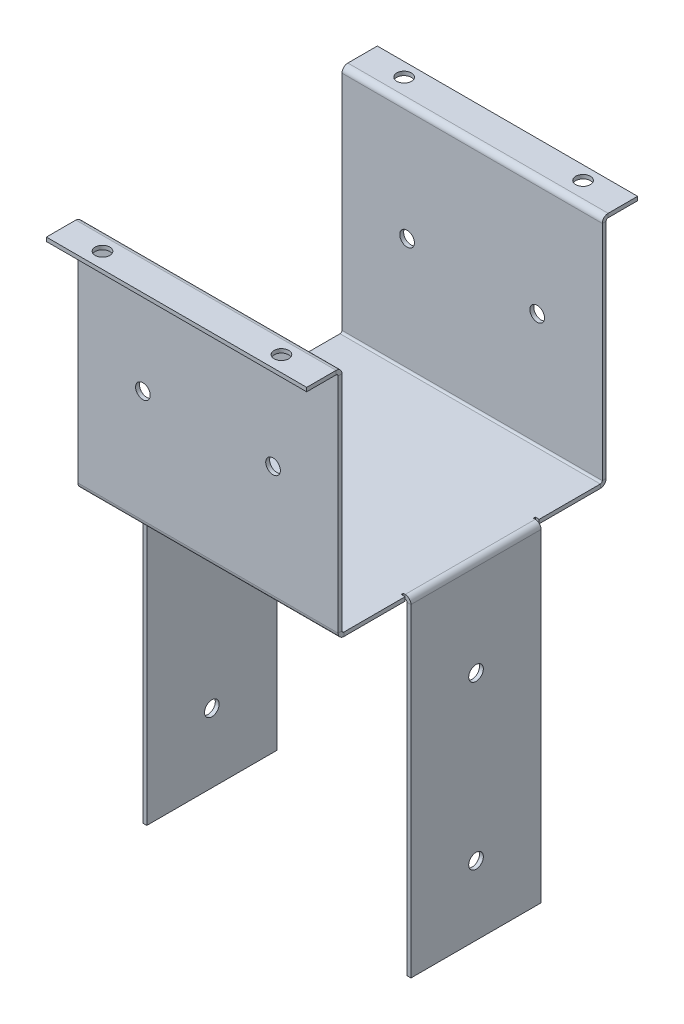
from build123d import *

# Parameters (mm, degrees)
BASE_FLANGE1_DEPTH              = 50.8
EDGE_FLANGE1_STRIP_W            = 7.59968
EDGE_FLANGE1_STRIP_H            = 1.51892
EDGE_FLANGE1_STRIP_CUT_DEPTH    = 50.8
EDGE_FLANGE1_RELIEF_W           = 8.35914
EDGE_FLANGE1_RELIEF_H           = 0.75946
EDGE_FLANGE1_RELIEF_CUT_DEPTH   = 1.51892
EDGE_FLANGE1_STRIP_2_W          = 7.59968
EDGE_FLANGE1_STRIP_2_H          = 1.51892
EDGE_FLANGE1_STRIP_CUT_2_DEPTH  = 50.8
EDGE_FLANGE1_RELIEF_2_W         = 8.35914
EDGE_FLANGE1_RELIEF_2_H         = 0.75946
EDGE_FLANGE1_RELIEF_CUT_2_DEPTH = 1.51892
EDGE_FLANGE1_DEPTH              = 50.8
EDGE_FLANGE1_BEND_DEPTH         = 50.8
SKETCHED_START                  = -50.8
SKETCHED_BEND1_DEPTH            = 101.6
SKETCHED_BEND1_2_DEPTH          = 101.6
SKETCHED_BEND2_DEPTH            = 101.6
SKETCHED_BEND2_2_DEPTH          = 101.6
SKETCH15_R                      = 2.8575
CUT_EXTRUDE1_DEPTH              = 178.869439856
SKETCH17_R                      = 2.8575
CUT_EXTRUDE2_DEPTH              = 2.54
SKETCH18_R                      = 2.8575
CUT_EXTRUDE3_DEPTH              = 182.441822775


# Read off the part's stored shape, not the designer's step: Sketched Bend1, Sketched Bend2
# Sheet-metal steps are written as plain solids
with BuildPart() as part:
    # Sketch2 → Base-Flange1 (new, symmetric)
    with BuildSketch(Plane(origin=(0, 0, 0), x_dir=(0, 0, -1), z_dir=(1, 0, 0))):
        with BuildLine():
            Line((-50.8, 101.6), (-50.8, 0.762))
            ThreePointArc((-50.8, 0.762), (-50.576815367, 0.223184633), (-50.038, 0))
            Line((-50.038, 0), (50.038, 0))
            ThreePointArc((50.038, 0), (50.576815367, 0.223184633), (50.8, 0.762))
            Line((50.8, 0.762), (50.8, 101.6))
            Line((50.8, 101.6), (52.31892, 101.6))
            Line((52.31892, 101.6), (52.31892, 0.762))
            ThreePointArc((52.31892, 0.762), (51.650853999, -0.850853999), (50.038, -1.51892))
            Line((50.038, -1.51892), (-50.038, -1.51892))
            ThreePointArc((-50.038, -1.51892), (-51.650853999, -0.850853999), (-52.31892, 0.762))
            Line((-52.31892, 0.762), (-52.31892, 101.6))
            Line((-52.31892, 101.6), (-50.8, 101.6))
        make_face()
    extrude(amount=BASE_FLANGE1_DEPTH, both=True)

    # Edge-Flange1 strip (across the edge) → Edge-Flange1 strip cut (cut)
    with BuildSketch(Plane(origin=(50.8, -1.51892, -25.4), x_dir=(-1, 0, 0), z_dir=(0, 0, 1))):
        with Locations((-3.03784, -0.75946)):
            Rectangle(EDGE_FLANGE1_STRIP_W, EDGE_FLANGE1_STRIP_H)
    extrude(amount=EDGE_FLANGE1_STRIP_CUT_DEPTH, mode=Mode.SUBTRACT)

    # Edge-Flange1 relief (on the sheet) → Edge-Flange1 relief cut (cut)
    with BuildSketch(Plane(origin=(50.038, -1.51892, -25.4), x_dir=(-1, 0, 0), z_dir=(0, -1, 0))):
        with Locations((-3.42011, 0.37973)):
            Rectangle(EDGE_FLANGE1_RELIEF_W, EDGE_FLANGE1_RELIEF_H)
        with Locations((-3.42011, -51.17973)):
            Rectangle(EDGE_FLANGE1_RELIEF_W, EDGE_FLANGE1_RELIEF_H)
    extrude(amount=-EDGE_FLANGE1_RELIEF_CUT_DEPTH, mode=Mode.SUBTRACT)

    # Edge-Flange1 strip 2 (across the edge) → Edge-Flange1 strip cut 2 (cut)
    with BuildSketch(Plane(origin=(-50.8, -1.51892, 25.4), x_dir=(1, 0, 0), z_dir=(0, 0, -1))):
        with Locations((-3.03784, -0.75946)):
            Rectangle(EDGE_FLANGE1_STRIP_2_W, EDGE_FLANGE1_STRIP_2_H)
    extrude(amount=EDGE_FLANGE1_STRIP_CUT_2_DEPTH, mode=Mode.SUBTRACT)

    # Edge-Flange1 relief 2 (on the sheet) → Edge-Flange1 relief cut 2 (cut)
    with BuildSketch(Plane(origin=(-50.038, -1.51892, 25.4), x_dir=(1, 0, 0), z_dir=(0, -1, 0))):
        with Locations((-3.42011, 0.37973)):
            Rectangle(EDGE_FLANGE1_RELIEF_2_W, EDGE_FLANGE1_RELIEF_2_H)
        with Locations((-3.42011, -51.17973)):
            Rectangle(EDGE_FLANGE1_RELIEF_2_W, EDGE_FLANGE1_RELIEF_2_H)
    extrude(amount=-EDGE_FLANGE1_RELIEF_CUT_2_DEPTH, mode=Mode.SUBTRACT)

    # Edge-Flange1 section (across the edge) → Edge-Flange1 (add)
    with BuildSketch(Plane(origin=(50.8, -1.51892, -25.4), x_dir=(-1, 0, 0), z_dir=(0, 0, 1))):
        with BuildLine():
            Line((-1.51892, 0.762), (-1.51892, 127))
            Line((-1.51892, 127), (0, 127))
            Line((0, 127), (0, 0.762))
            ThreePointArc((0, 0.762), (0.223184633, 0.223184633), (0.762, 0))
            Line((0.762, 0), (0.762, -1.51892))
            ThreePointArc((0.762, -1.51892), (-0.850853999, -0.850853999), (-1.51892, 0.762))
        make_face()
    extrude(amount=EDGE_FLANGE1_DEPTH)

    # Edge-Flange1 section 2 (across the edge) → Edge-Flange1 bend (add)
    with BuildSketch(Plane(origin=(-50.8, -1.51892, 25.4), x_dir=(1, 0, 0), z_dir=(0, 0, -1))):
        with BuildLine():
            Line((-1.51892, 0.762), (-1.51892, 127))
            Line((-1.51892, 127), (0, 127))
            Line((0, 127), (0, 0.762))
            ThreePointArc((0, 0.762), (0.223184633, 0.223184633), (0.762, 0))
            Line((0.762, 0), (0.762, -1.51892))
            ThreePointArc((0.762, -1.51892), (-0.850853999, -0.850853999), (-1.51892, 0.762))
        make_face()
    extrude(amount=EDGE_FLANGE1_BEND_DEPTH)

    # Sketched Bend1 outline → Sketched Bend1 (cut)
    with BuildSketch(Plane.YZ.offset(SKETCHED_START)):
        with BuildLine():
            ThreePointArc((89.854920675, 52.31892), (89.021204447, 51.218038215), (87.70504811, 50.8))
            Line((87.70504811, 50.8), (101.6, 50.8))
            Line((101.6, 50.8), (101.6, 52.31892))
            Line((101.6, 52.31892), (89.854920675, 52.31892))
        make_face()
    extrude(amount=SKETCHED_BEND1_DEPTH, mode=Mode.SUBTRACT)

    # Sketched Bend1 2 outline → Sketched Bend1 2 (add)
    with BuildSketch(Plane.YZ.offset(SKETCHED_START)):
        with BuildLine():
            Line((87.70504811, 52.31892), (89.854920675, 52.31892))
            ThreePointArc((89.854920675, 52.31892), (89.952967523, 52.694326729), (89.98596811, 53.08092))
            Line((89.98596811, 53.08092), (89.98596811, 64.58596811))
            Line((89.98596811, 64.58596811), (88.46704811, 64.58596811))
            Line((88.46704811, 64.58596811), (88.46704811, 53.08092))
            ThreePointArc((88.46704811, 53.08092), (88.243863477, 52.542104633), (87.70504811, 52.31892))
        make_face()
    extrude(amount=SKETCHED_BEND1_2_DEPTH)

    # Sketched Bend2 outline → Sketched Bend2 (cut)
    with BuildSketch(Plane.YZ.offset(SKETCHED_START)):
        with BuildLine():
            ThreePointArc((87.70504811, -50.8), (89.021204447, -51.218038215), (89.854920675, -52.31892))
            Line((89.854920675, -52.31892), (101.6, -52.31892))
            Line((101.6, -52.31892), (101.6, -50.8))
            Line((101.6, -50.8), (87.70504811, -50.8))
        make_face()
    extrude(amount=SKETCHED_BEND2_DEPTH, mode=Mode.SUBTRACT)

    # Sketched Bend2 2 outline → Sketched Bend2 2 (add)
    with BuildSketch(Plane.YZ.offset(SKETCHED_START)):
        with BuildLine():
            Line((88.46704811, -64.58596811), (89.98596811, -64.58596811))
            Line((89.98596811, -64.58596811), (89.98596811, -53.08092))
            ThreePointArc((89.98596811, -53.08092), (89.952967523, -52.694326729), (89.854920675, -52.31892))
            Line((89.854920675, -52.31892), (87.70504811, -52.31892))
            ThreePointArc((87.70504811, -52.31892), (88.243863477, -52.542104633), (88.46704811, -53.08092))
            Line((88.46704811, -53.08092), (88.46704811, -64.58596811))
        make_face()
    extrude(amount=SKETCHED_BEND2_2_DEPTH)

    # Sketch15 → Cut-Extrude1 (cut, through all)
    with BuildSketch(Plane(origin=(52.31892, 0, 0), x_dir=(0, 0, -1), z_dir=(1, 0, 0))):
        with Locations(Location((0, -38.1, 0), (0, 0, 90))):
            Circle(SKETCH15_R)
        with Locations(Location((0, -101.6, 0), (0, 0, 90))):
            Circle(SKETCH15_R)
    extrude(amount=-CUT_EXTRUDE1_DEPTH, mode=Mode.SUBTRACT)

    # Sketch17 → Cut-Extrude2 (cut)
    with BuildSketch(Plane(origin=(0, 89.98596811, 0), x_dir=(1, 0, 0), z_dir=(0, 1, 0))):
        with Locations(Location((-35.052, 59.305404319, 0), (0, 0, 270))):
            Circle(SKETCH17_R)
        with Locations(Location((34.798, 59.305404319, 0), (0, 0, 270))):
            Circle(SKETCH17_R)
        with Locations(Location((-35.052, -58.440894052, 0), (0, 0, 270))):
            Circle(SKETCH17_R)
        with Locations(Location((34.798, -58.440894052, 0), (0, 0, 270))):
            Circle(SKETCH17_R)
    extrude(amount=-CUT_EXTRUDE2_DEPTH, mode=Mode.SUBTRACT)

    # Sketch18 → Cut-Extrude3 (cut, through all)
    with BuildSketch(Plane.XY.offset(52.31892)):
        with Locations((-25.4, 44.45)):
            Circle(SKETCH18_R)
        with Locations((25.4, 44.45)):
            Circle(SKETCH18_R)
    extrude(amount=-CUT_EXTRUDE3_DEPTH, mode=Mode.SUBTRACT)


solid = part.part
